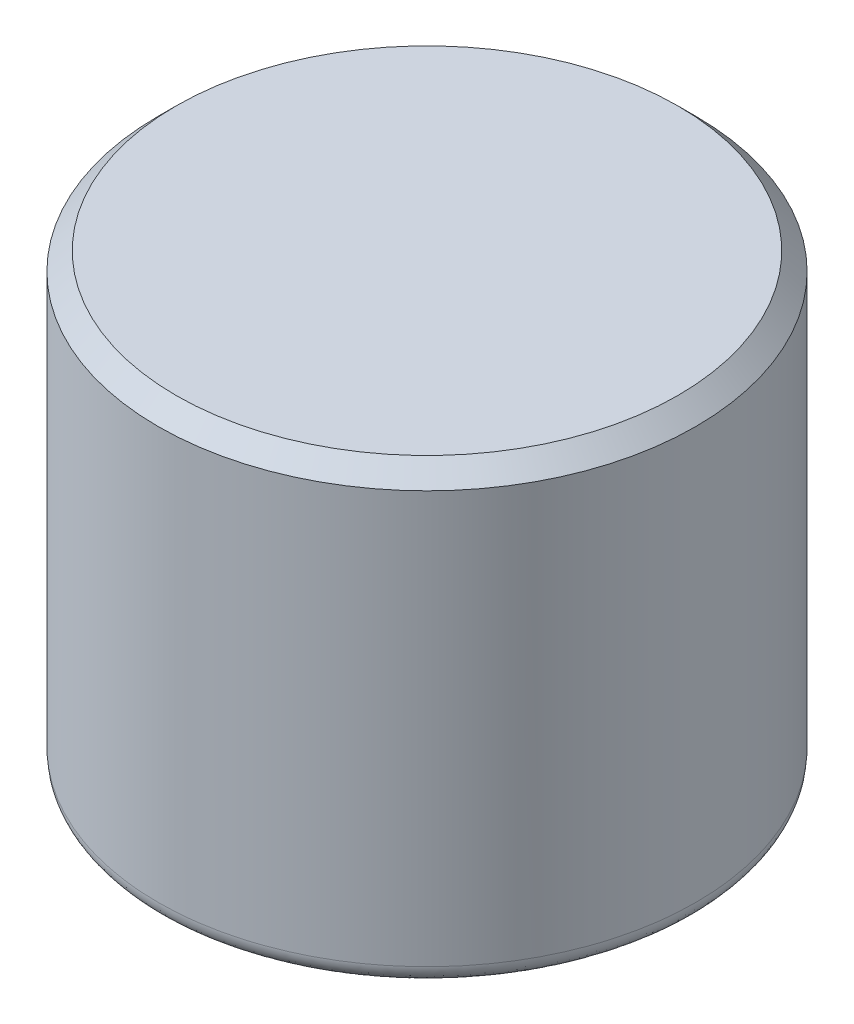
from build123d import *

# Parameters (mm, degrees)
CHAMFER1_SIZE      = 1
FILLET1_SIZE       = 1
SKETCH3_R          = 1.1303
CUT_EXTRUDE1_DEPTH = 15
THREAD1_PITCH      = 0.635


with BuildPart() as part:
    # Sketch2 → Revolve1 (revolve)
    with BuildSketch(Plane.XY, mode=Mode.PRIVATE) as revolve1_sk:
        Polygon((0, 0), (15, 0), (15, -25), (6.764101615, -25), (3.3, -23), (3.3, -13), (0, -13), align=None)
    revolve(revolve1_sk.sketch.rotate(Axis((0, -28.875, 0), (0, 1, 0)), 90), axis=Axis((0, -28.875, 0), (0, 1, 0)))

    # Chamfer1
    chamfer1_edges = [part.edges().sort_by_distance(p)[0] for p in [
        (0, 0, 15),
    ]]
    chamfer(chamfer1_edges, length=CHAMFER1_SIZE)

    # Fillet1
    # a fillet whose section is not a circle: 1 mm, written as the material it takes off along each edge
    with BuildSketch(Plane(origin=(0, -23, 0), x_dir=(0, 0, -1), z_dir=(1, 0, 0))) as fillet1_piece_1:
        with BuildLine():
            Bezier((3.8, -0.288675135), (3.3, 0), (3.3, 0.577350269), weights=[1, 0.818181818, 1])
            Line((3.3, 0.577350269), (3.3, 0))
            Line((3.3, 0), (3.8, -0.288675135))
        make_face()
    revolve(axis=Axis((0, -23, 0), (0, 1, 0)), mode=Mode.SUBTRACT)
    with BuildSketch(Plane(origin=(0, -25, 0), x_dir=(0, 0, -1), z_dir=(1, 0, 0))) as fillet1_piece_2:
        with BuildLine():
            Bezier((7.032050808, 0), (6.764101615, 0), (6.532050808, 0.133974596), weights=[1, 0.818181818, 1])
            Line((6.532050808, 0.133974596), (6.764101615, 0))
            Line((6.764101615, 0), (7.032050808, 0))
        make_face()
    revolve(axis=Axis((0, -25, 0), (0, 1, 0)), mode=Mode.SUBTRACT)
    with BuildSketch(Plane(origin=(0, -25, 0), x_dir=(0, 0, -1), z_dir=(1, 0, 0))) as fillet1_piece_3:
        with BuildLine():
            Bezier((15, FILLET1_SIZE), (15, 0), (15 - FILLET1_SIZE, 0), weights=[1, 0.818181818, 1])
            Line((15 - FILLET1_SIZE, 0), (15, 0))
            Line((15, 0), (15, FILLET1_SIZE))
        make_face()
    revolve(axis=Axis((0, -25, 0), (0, 1, 0)), mode=Mode.SUBTRACT)

    # Sketch3 → Cut-Extrude1 (cut)
    with BuildSketch(Plane(origin=(0, 0, 0), x_dir=(0, 0, -1), z_dir=(1, 0, 0))):
        with Locations((0, -16)):
            Circle(SKETCH3_R)
    extrude(amount=-CUT_EXTRUDE1_DEPTH, mode=Mode.SUBTRACT)

    # Thread1: arcs per turn and ends read off the stored shape
    # Thread1: the profile of Thread Profile3 profile screwed along a right-hand helix through 22.047244 turns, 6 arcs to a turn; built about Z, then put on its axis
    thread1_z = Axis((0, 0, 0), (0, 0, 1))
    thread1_corners = [(1.13, 0, -0.000173205), (1.474003831, 0, 0.198437499), (1.474003831, 0, 0.277812499), (1.13, 0, 0.476423203)]
    with BuildLine(mode=Mode.PRIVATE) as thread1_profile:
        Line(thread1_corners[0], thread1_corners[1])
        Line(thread1_corners[1], thread1_corners[2])
        Line(thread1_corners[2], thread1_corners[3])
        Line(thread1_corners[3], thread1_corners[0])
    thread1_cap = Face(thread1_profile.wire())
    thread1_turn_angles = [0, 30, 60, 90, 120, 150, 180, 210, 240, 270, 300, 330, 360]
    thread1_turn_weights = [1, 0.8660254037844387, 1, 0.8660254037844387, 1, 0.8660254037844387, 1, 0.8660254037844387, 1, 0.8660254037844387, 1, 0.8660254037844387, 1]
    thread1_turn_rails = [Edge.make_bspline([Vector(p[0], p[1], 0).rotate(thread1_z, thread1_turn_angles[k]) / thread1_turn_weights[k] + Vector(0, 0, p[2] + THREAD1_PITCH * thread1_turn_angles[k] / 360) for k in range(13)], [0, 0, 0, 1, 1, 2, 2, 3, 3, 4, 4, 5, 5, 6, 6, 6], 2, thread1_turn_weights) for p in thread1_corners]
    thread1_turn_sides = [Face.make_surface_from_curves(thread1_turn_rails[p[0]], thread1_turn_rails[p[1]]) for p in [(0, 1), (1, 2), (2, 3), (3, 0)]]
    thread1_last_angles = [7920, 7928.503937008, 7937.007874016]
    thread1_last_weights = [1, 0.989005704488131, 1]
    thread1_last_rails = [Edge.make_bspline([Vector(p[0], p[1], 0).rotate(thread1_z, thread1_last_angles[k]) / thread1_last_weights[k] + Vector(0, 0, p[2] + THREAD1_PITCH * thread1_last_angles[k] / 360) for k in range(3)], [0, 0, 0, 1, 1, 1], 2, thread1_last_weights) for p in thread1_corners]
    thread1_last_sides = [Face.make_surface_from_curves(thread1_last_rails[p[0]], thread1_last_rails[p[1]]) for p in [(0, 1), (1, 2), (2, 3), (3, 0)]]
    thread1 = Plane(origin=(-16, -16, 0), x_dir=(0, 0, -1), z_dir=(1, 0, 0)) * Solid(Shell([*[p.moved(Location((0, 0, THREAD1_PITCH * i))) for i in range(22) for p in thread1_turn_sides], *thread1_last_sides, thread1_cap, thread1_cap.rotate(thread1_z, 7937.007874016).moved(Location((0, 0, THREAD1_PITCH * 7937.007874016 / 360)))]))
    add(thread1, mode=Mode.SUBTRACT)


solid = part.part
